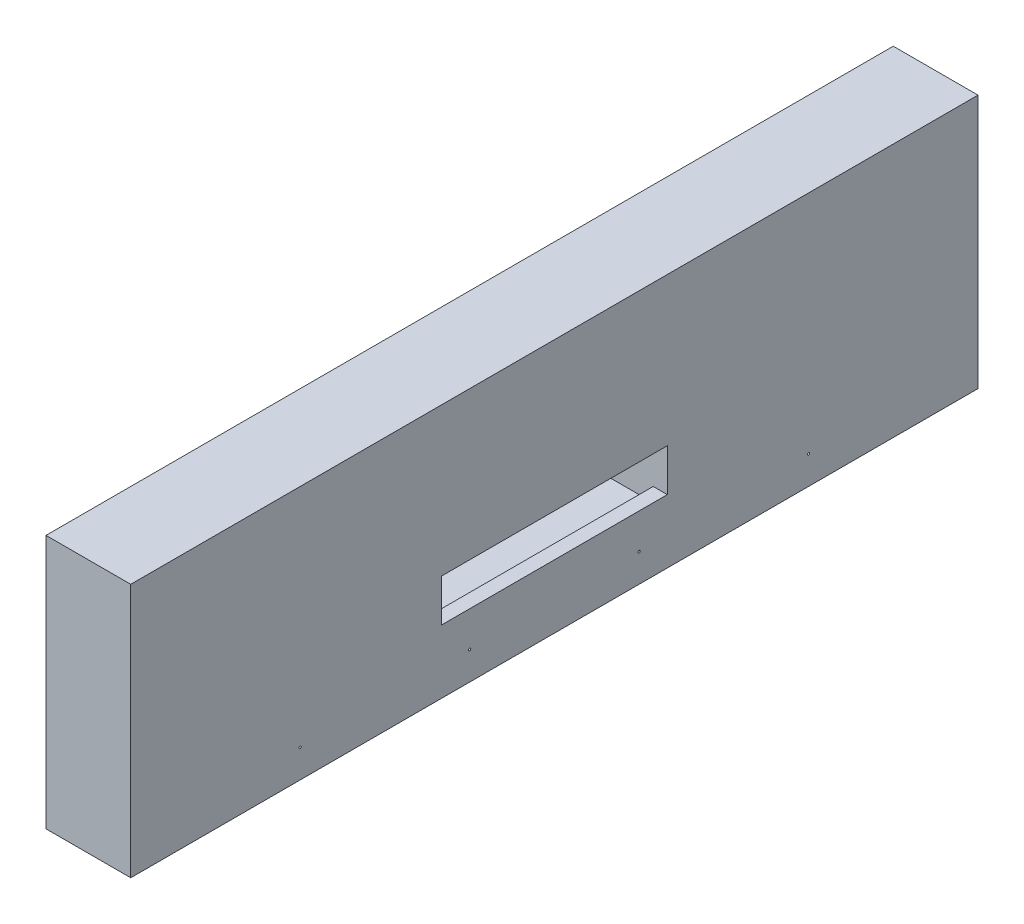
from build123d import *

# Parameters (mm, degrees)
SKETCH1_W           = 762
SKETCH1_H           = 228.6
BOSS_EXTRUDE1_DEPTH = 76.2
SKETCH2_W           = 203.2
SKETCH2_H           = 95.25
CUT_EXTRUDE1_DEPTH  = 63.5
SKETCH3_W           = 203.2
SKETCH3_H           = 38.1
CUT_EXTRUDE2_DEPTH  = 799.081581043
FILLET1_R           = 25.4
SKETCH4_R           = 1.016
CUT_EXTRUDE3_DEPTH  = 800.192342306
LPATTERN1_COUNT     = 4
LPATTERN1_PITCH     = 152.4


with BuildPart() as part:
    # Sketch1 → Boss-Extrude1 (new body)
    with BuildSketch(Plane(origin=(0, 0, 0), x_dir=(0, 0, -1), z_dir=(1, 0, 0))):
        with Locations((381, 114.3)):
            Rectangle(SKETCH1_W, SKETCH1_H)
    extrude(amount=BOSS_EXTRUDE1_DEPTH)

    # Sketch2 → Cut-Extrude1 (cut)
    with BuildSketch(Plane.ZY):
        with Locations((-381, 92.075)):
            Rectangle(SKETCH2_W, SKETCH2_H)
    extrude(amount=-CUT_EXTRUDE1_DEPTH, mode=Mode.SUBTRACT)

    # Sketch3 → Cut-Extrude2 (cut, through all)
    with BuildSketch(Plane.ZY.offset(-63.5)):
        with Locations((-381, 76.2)):
            Rectangle(SKETCH3_W, SKETCH3_H)
    extrude(amount=-CUT_EXTRUDE2_DEPTH, mode=Mode.SUBTRACT)

    # Fillet1
    fillet1_edges = [part.edges().sort_by_distance(p)[0] for p in [
        (31.75, 139.7, -279.4),
        (31.75, 139.7, -482.6),
    ]]
    fillet(fillet1_edges, radius=FILLET1_R)

    # Sketch4 → Cut-Extrude3 (cut, through all)
    with BuildSketch(Plane.ZY):
        with Locations((-609.6, 25.4)):
            Circle(SKETCH4_R)
    cut_extrude3 = extrude(amount=-CUT_EXTRUDE3_DEPTH, mode=Mode.SUBTRACT)

    # LPattern1: Cut-Extrude3 ×4
    with Locations(*[(0, 0, i * LPATTERN1_PITCH) for i in range(1, LPATTERN1_COUNT)]):
        add(cut_extrude3, mode=Mode.SUBTRACT)


solid = part.part
